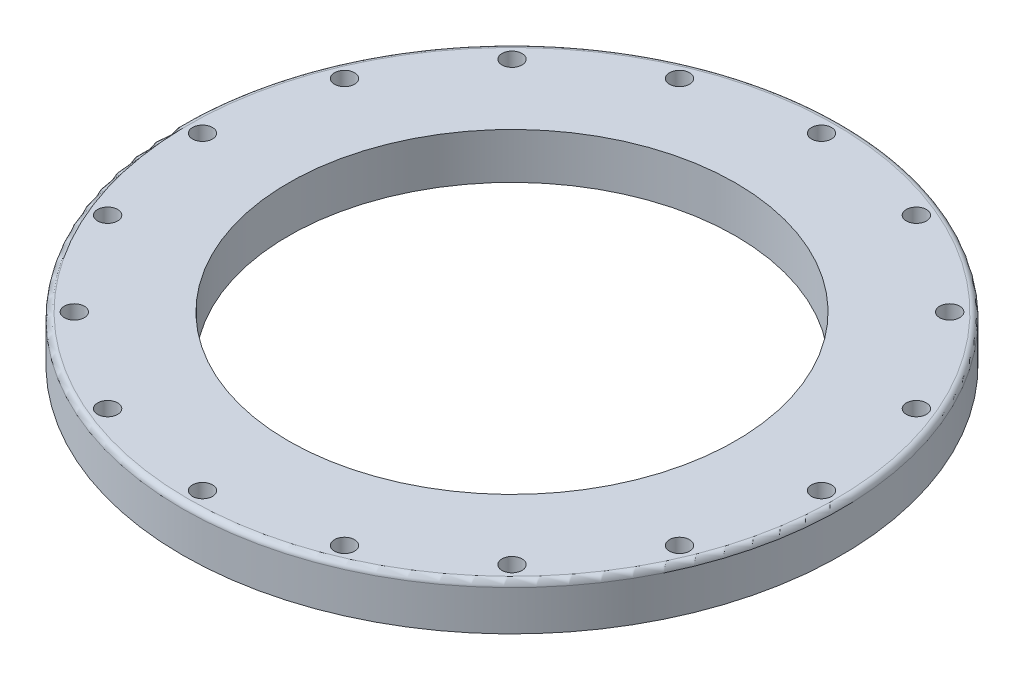
from build123d import *

# Parameters (mm, degrees)
SKETCH1_R           = 57.5
SKETCH1_R_2         = 39
BOSS_EXTRUDE1_DEPTH = 8
SKETCH2_R           = 1.75
CUT_EXTRUDE1_DEPTH  = 25
FILLET1_R           = 1


with BuildPart() as part:
    # Sketch1 → Boss-Extrude1 (new body)
    with BuildSketch(Plane(origin=(0, 0, 0), x_dir=(1, 0, 0), z_dir=(0, 1, 0))):
        Circle(SKETCH1_R)
        Circle(SKETCH1_R_2, mode=Mode.SUBTRACT)
    extrude(amount=BOSS_EXTRUDE1_DEPTH)

    # Sketch2 → Cut-Extrude1 (cut)
    with BuildSketch(Plane(origin=(0, 8, 0), x_dir=(1, 0, 0), z_dir=(0, 1, 0))):
        with Locations((0, 54)):
            Circle(SKETCH2_R)
        with Locations((20.664905348, 49.889494756)):
            Circle(SKETCH2_R)
        with Locations((38.183766184, 38.183766184)):
            Circle(SKETCH2_R)
        with Locations((49.889494756, 20.664905348)):
            Circle(SKETCH2_R)
        with Locations((54, 0)):
            Circle(SKETCH2_R)
        with Locations((49.889494756, -20.664905348)):
            Circle(SKETCH2_R)
        with Locations((38.183766184, -38.183766184)):
            Circle(SKETCH2_R)
        with Locations((20.664905348, -49.889494756)):
            Circle(SKETCH2_R)
        with Locations((0, -54)):
            Circle(SKETCH2_R)
        with Locations((-20.664905348, -49.889494756)):
            Circle(SKETCH2_R)
        with Locations((-38.183766184, -38.183766184)):
            Circle(SKETCH2_R)
        with Locations((-49.889494756, -20.664905348)):
            Circle(SKETCH2_R)
        with Locations((-54, 0)):
            Circle(SKETCH2_R)
        with Locations((-49.889494756, 20.664905348)):
            Circle(SKETCH2_R)
        with Locations((-38.183766184, 38.183766184)):
            Circle(SKETCH2_R)
        with Locations((-20.664905348, 49.889494756)):
            Circle(SKETCH2_R)
    extrude(amount=-CUT_EXTRUDE1_DEPTH, mode=Mode.SUBTRACT)

    # Fillet1
    fillet1_edges = [part.edges().sort_by_distance(p)[0] for p in [
        (-57.5, 8, 0),
    ]]
    fillet(fillet1_edges, radius=FILLET1_R)


solid = part.part
